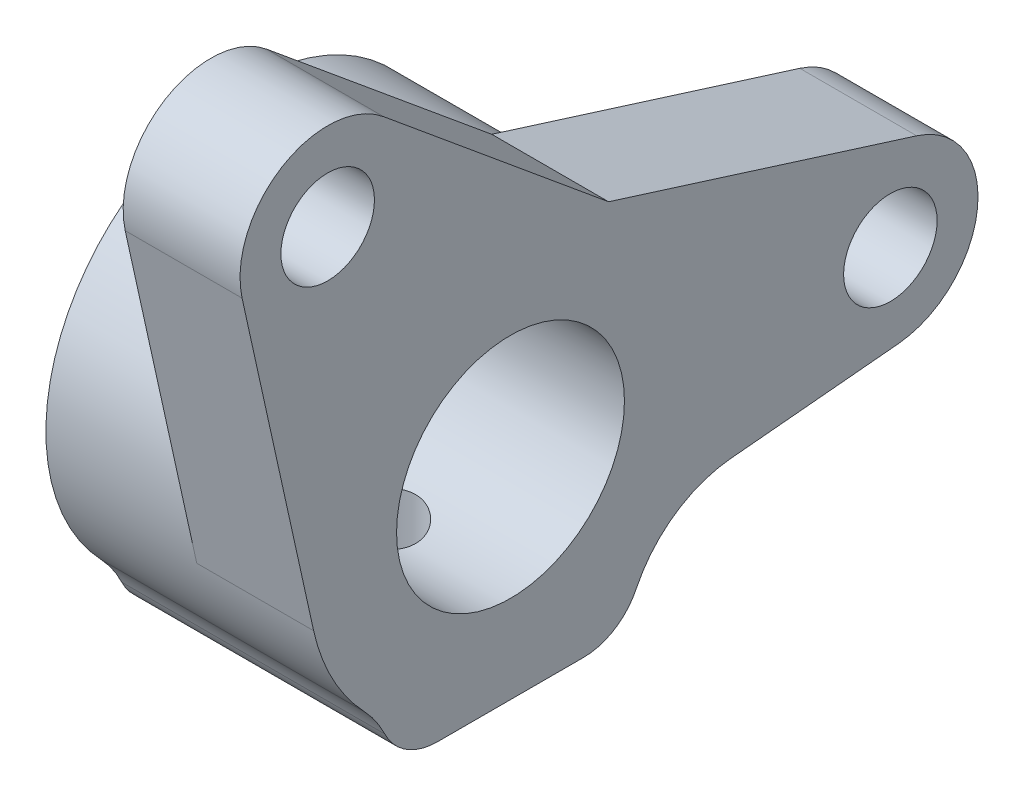
from build123d import *

# Parameters (mm, degrees)
BOSS_EXTRUDE1_START     = -10.5
SKETCH2_R               = 3.9
BOSS_EXTRUDE1_DEPTH     = 4
BOSS_EXTRUDE2_START     = -15.5
BOSS_EXTRUDE2_OUTLINE_R = 3.9
BOSS_EXTRUDE2_DEPTH     = 5
M3_CLEARANCE_HOLE1_D    = 3.2
M3_TAPPED_HOLE1_REACH   = 32.031
M3_TAPPED_HOLE1_BORE_R  = 1.25


# Read off the part's stored shape, not the designer's step: Boss-Extrude2
with BuildPart() as part:
    # Sketch2 → Boss-Extrude1 (new body)
    with BuildSketch(Plane(origin=(0, 0, 0), x_dir=(0, 0, -1), z_dir=(1, 0, 0)).offset(BOSS_EXTRUDE1_START)):
        with BuildLine():
            Line((7.534547605, -3.521676906), (13.278030312, -2.987088741))
            ThreePointArc((13.278030312, -2.987088741), (15.983180385, -0.317229866), (13.9, 2.861817604))
            Line((13.9, 2.861817604), (3.358528015, 6.176957176))
            Line((3.358528015, 6.176957176), (-4.343824749, 12.551142838))
            ThreePointArc((-4.343824749, 12.551142838), (-7.820620852, 12.799917558), (-9.185849324, 9.592714537))
            Line((-9.185849324, 9.592714537), (-6.737511079, -1.488604871))
            ThreePointArc((-6.737511079, -1.488604871), (-6.093212803, -3.237708717), (-5.004243793, -4.750530924))
            ThreePointArc((-5.004243793, -4.750530924), (-4.613436828, -5.232032538), (-4.301751563, -5.768153965))
            ThreePointArc((-4.301751563, -5.768153965), (-3.563882529, -6.593562507), (-2.5, -6.9))
            Line((-2.5, -6.9), (2.5, -6.9))
            ThreePointArc((2.5, -6.9), (3.563882529, -6.593562507), (4.301751563, -5.768153965))
            ThreePointArc((4.301751563, -5.768153965), (5.622657157, -4.219686633), (7.534547605, -3.521676906))
        make_face()
        Circle(SKETCH2_R, mode=Mode.SUBTRACT)
    extrude(amount=BOSS_EXTRUDE1_DEPTH)

    # Boss-Extrude2 outline → Boss-Extrude2 (add)
    with BuildSketch(Plane(origin=(0, 0, 0), x_dir=(0, 0, -1), z_dir=(1, 0, 0)).offset(BOSS_EXTRUDE2_START)):
        with BuildLine():
            ThreePointArc((5.004243793, -4.750530924), (0, 6.9), (-5.004243793, -4.750530924))
            ThreePointArc((-5.004243793, -4.750530924), (-4.613436828, -5.232032538), (-4.301751563, -5.768153965))
            ThreePointArc((-4.301751563, -5.768153965), (-3.563882529, -6.593562507), (-2.5, -6.9))
            Line((-2.5, -6.9), (2.5, -6.9))
            ThreePointArc((2.5, -6.9), (3.563882529, -6.593562507), (4.301751563, -5.768153965))
            ThreePointArc((4.301751563, -5.768153965), (4.613436828, -5.232032538), (5.004243793, -4.750530924))
        make_face()
        Circle(BOSS_EXTRUDE2_OUTLINE_R, mode=Mode.SUBTRACT)
    extrude(amount=BOSS_EXTRUDE2_DEPTH)

    # M3 Clearance Hole1 (through all)
    with Locations(Plane.ZY.offset(10.5)):
        with Locations((-13, 0), (6.256496681, 10.239934047)):
            Hole(M3_CLEARANCE_HOLE1_D / 2)

    # M3 Tapped Hole1 bore → M3 Tapped Hole1 (cut, up to next)
    with BuildSketch(Plane(origin=(0, -6.9, 0), x_dir=(-1, 0, 0), z_dir=(0, -1, 0)), mode=Mode.PRIVATE) as m3_tapped_hole1_sk1:
        with Locations((11, 0)):
            Circle(M3_TAPPED_HOLE1_BORE_R)
    m3_tapped_hole1_tool1 = extrude(m3_tapped_hole1_sk1.sketch, amount=-M3_TAPPED_HOLE1_REACH, mode=Mode.PRIVATE) & part.part
    add(m3_tapped_hole1_tool1.solids().sort_by_distance((-11, -6.9, 0))[0], mode=Mode.SUBTRACT)


solid = part.part
